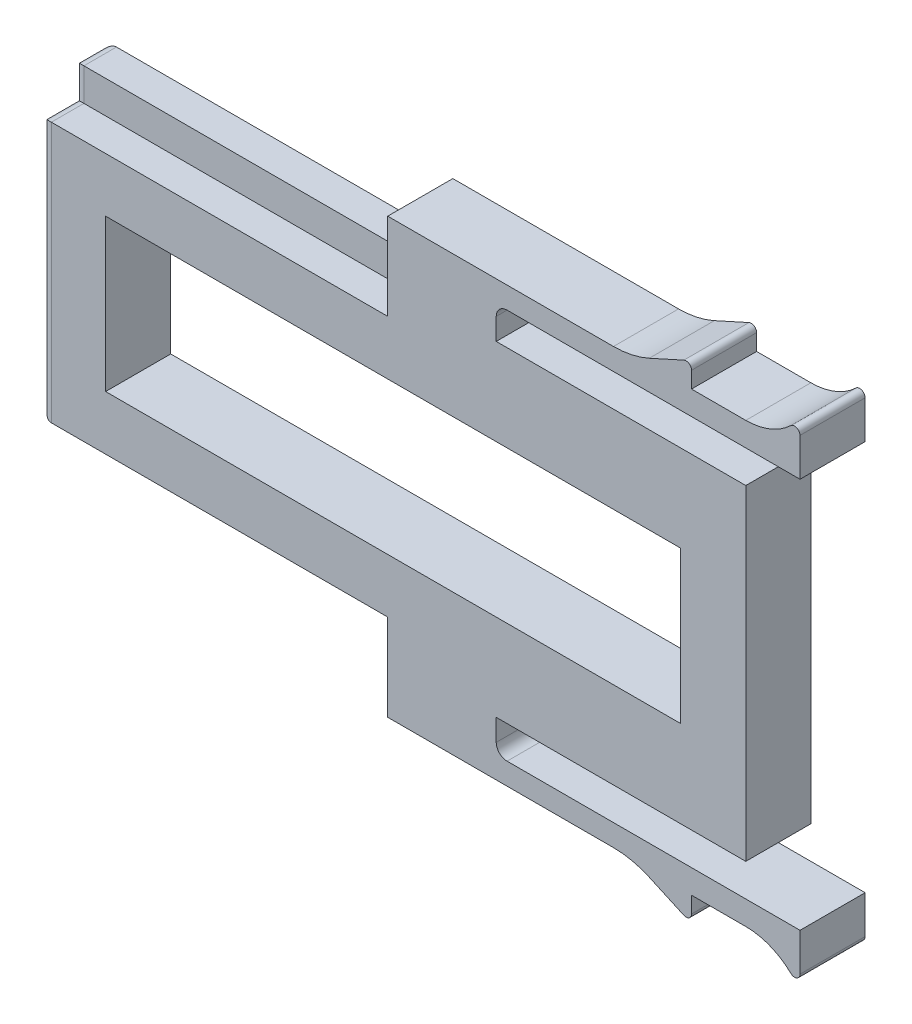
from build123d import *

# Parameters (mm, degrees)
BOSS_EXTRUDE1_DEPTH = 6
SKETCH4_W           = 3
SKETCH4_H           = 3
CUT_EXTRUDE2_DEPTH  = 32
FILLET1_R           = 1
SKETCH6_W           = 53
SKETCH6_H           = 14
CUT_EXTRUDE4_DEPTH  = 44.989657875


with BuildPart() as part:
    # Sketch1 → Boss-Extrude1 (new body)
    with BuildSketch(Plane(origin=(0, 0, 0), x_dir=(0, 1, 0), z_dir=(0, 0, 1))):
        with BuildLine():
            Line((-15, -9.5), (-17, -9.5))
            ThreePointArc((-17, -9.5), (-17.707106781, -9.792893219), (-18, -10.5))
            Line((-18, -10.5), (-18, -27.5))
            Line((-18, -27.5), (-18, -37.5))
            Line((-18, -37.5), (-21.5, -37.5))
            ThreePointArc((-21.5, -37.5), (-21.959572515, -37.196959649), (-21.862068966, -36.655172414))
            ThreePointArc((-21.862068966, -36.655172414), (-20.630927937, -34.737628825), (-20.2, -32.5))
            Line((-20.2, -32.5), (-20.2, -27.5))
            Line((-20.2, -27.5), (-21.7, -27.5))
            ThreePointArc((-21.7, -27.5), (-22.120181053, -27.271012699), (-22.155497604, -26.793791532))
            Line((-22.155497604, -26.793791532), (-20.712038328, -23.6053083))
            ThreePointArc((-20.712038328, -23.6053083), (-20.180035378, -21.993620083), (-20, -20.305972812))
            Line((-20, -20.305972812), (-20, -9.5))
            Line((-20, -9.5), (-20, 0.5))
            Line((-20, 0.5), (-15, 0.5))
            Line((-15, 0.5), (-15, 32.5))
            Line((-15, 32.5), (15, 32.5))
            Line((15, 32.5), (15, 0.5))
            Line((15, 0.5), (20, 0.5))
            Line((20, 0.5), (20, -9.5))
            Line((20, -9.5), (20, -20.305972812))
            ThreePointArc((20, -20.305972812), (20.180035378, -21.993620083), (20.712038328, -23.6053083))
            Line((20.712038328, -23.6053083), (22.155497604, -26.793791532))
            ThreePointArc((22.155497604, -26.793791532), (22.120181053, -27.271012699), (21.7, -27.5))
            Line((21.7, -27.5), (20.2, -27.5))
            Line((20.2, -27.5), (20.2, -32.5))
            ThreePointArc((20.2, -32.5), (20.630927937, -34.737628825), (21.862068966, -36.655172414))
            ThreePointArc((21.862068966, -36.655172414), (21.959572515, -37.196959649), (21.5, -37.5))
            Line((21.5, -37.5), (18, -37.5))
            Line((18, -37.5), (18, -27.5))
            Line((18, -27.5), (18, -10.5))
            ThreePointArc((18, -10.5), (17.707106781, -9.792893219), (17, -9.5))
            Line((17, -9.5), (15, -9.5))
            Line((15, -9.5), (15, -32.5))
            Line((15, -32.5), (-15, -32.5))
            Line((-15, -32.5), (-15, -9.5))
        make_face()
    extrude(amount=BOSS_EXTRUDE1_DEPTH)

    # Sketch4 → Cut-Extrude2 (cut)
    with BuildSketch(Plane(origin=(-32.5, 0, 0), x_dir=(0, -1, 0), z_dir=(-1, 0, 0))):
        with Locations((-13.5, 4.5)):
            Rectangle(SKETCH4_W, SKETCH4_H)
        with Locations((13.5, 4.5)):
            Rectangle(SKETCH4_W, SKETCH4_H)
    extrude(amount=-CUT_EXTRUDE2_DEPTH, mode=Mode.SUBTRACT)

    # Fillet1
    fillet1_edges = [part.edges().sort_by_distance(p)[0] for p in [
        (-32.5, 0, 6),
        (-32.5, -15, 1.5),
        (-32.5, 15, 1.5),
        (-32.5, 13.5, 3),
        (-32.5, 12, 4.5),
        (-32.5, -12, 4.5),
        (-32.5, -13.5, 3),
        (-32.5, 0, 0),
    ]]
    fillet(fillet1_edges, radius=FILLET1_R)

    # Sketch6 → Cut-Extrude4 (cut, through all)
    with BuildSketch(Plane.XY.offset(6)):
        Rectangle(SKETCH6_W, SKETCH6_H)
    extrude(amount=-CUT_EXTRUDE4_DEPTH, mode=Mode.SUBTRACT)


solid = part.part
